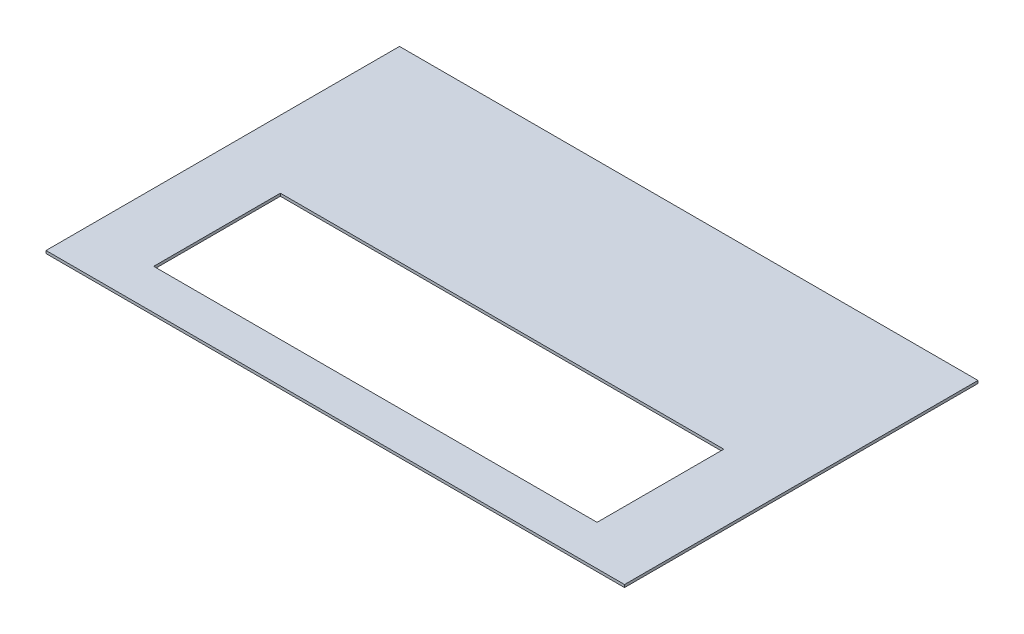
from build123d import *

# Parameters (mm, degrees)
SKETCH1_W           = 1370
SKETCH1_H           = 837.05
BOSS_EXTRUDE1_DEPTH = 6.35
CUT_EXTRUDE1_REACH  = 1607.488
SKETCH2_W           = 1050
SKETCH2_H           = 300


with BuildPart() as part:
    # Sketch1 → Boss-Extrude1 (new body)
    with BuildSketch(Plane(origin=(0, 0, 0), x_dir=(1, 0, 0), z_dir=(0, 1, 0))):
        with Locations((685, 418.525)):
            Rectangle(SKETCH1_W, SKETCH1_H)
    extrude(amount=BOSS_EXTRUDE1_DEPTH)

    # Sketch2 → Cut-Extrude1 (cut, up to next)
    with BuildSketch(Plane(origin=(0, 6.35, 0), x_dir=(1, 0, 0), z_dir=(0, 1, 0)), mode=Mode.PRIVATE) as cut_extrude1_sk1:
        with Locations((685, 245)):
            Rectangle(SKETCH2_W, SKETCH2_H)
    cut_extrude1_tool1 = extrude(cut_extrude1_sk1.sketch, amount=-CUT_EXTRUDE1_REACH, mode=Mode.PRIVATE) & part.part
    add(cut_extrude1_tool1.solids().sort_by_distance((685, 6.35, -245))[0], mode=Mode.SUBTRACT)


solid = part.part
